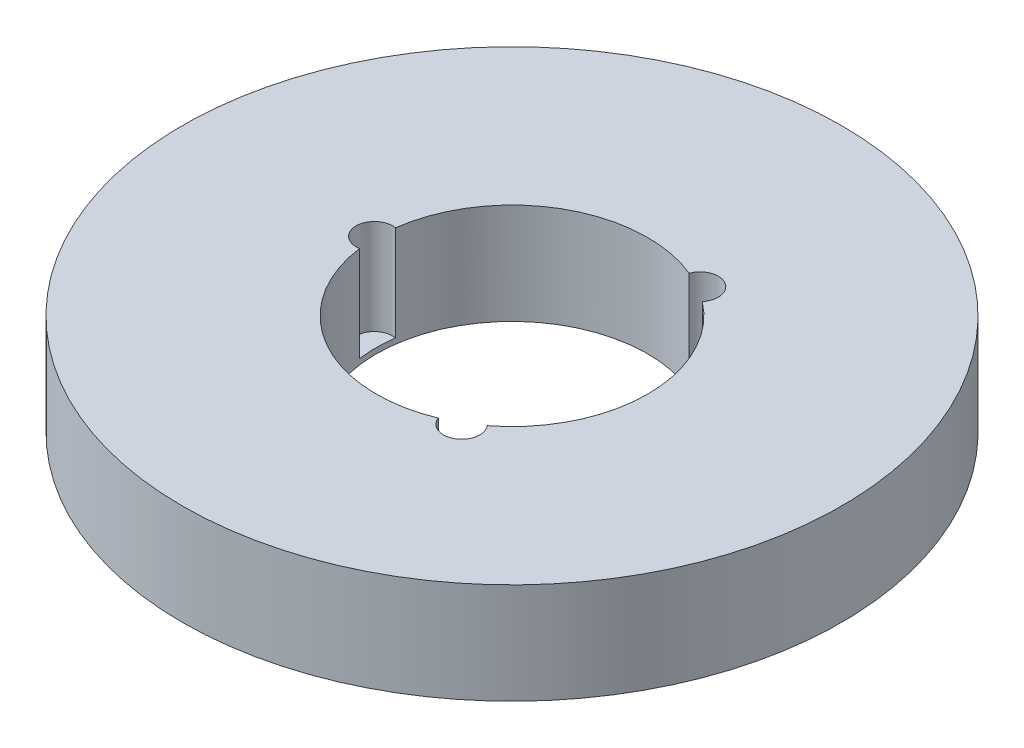
from build123d import *

# Parameters (mm, degrees)
SKETCH1_R           = 85
BOSS_EXTRUDE1_DEPTH = 26
SKETCH2_R           = 35
CUT_EXTRUDE1_DEPTH  = 123.987804273
SKETCH3_R           = 4.696834962
CUT_EXTRUDE2_DEPTH  = 24.590057638
CIRPATTERN1_COUNT   = 3


with BuildPart() as part:
    # Sketch1 → Boss-Extrude1 (new body)
    with BuildSketch(Plane(origin=(0, 0, 0), x_dir=(1, 0, 0), z_dir=(0, 1, 0))):
        Circle(SKETCH1_R)
    extrude(amount=BOSS_EXTRUDE1_DEPTH)

    # Sketch2 → Cut-Extrude1 (cut, through all)
    with BuildSketch(Plane(origin=(0, 0, 0), x_dir=(1, 0, 0), z_dir=(0, 1, 0))):
        Circle(SKETCH2_R)
    extrude(amount=CUT_EXTRUDE1_DEPTH, mode=Mode.SUBTRACT)

    # Sketch3 → Cut-Extrude2 (cut)
    with BuildSketch(Plane(origin=(0, 26, 0), x_dir=(1, 0, 0), z_dir=(0, 1, 0))):
        with Locations((-35.507515009, 0)):
            Circle(SKETCH3_R)
    cut_extrude2 = extrude(amount=-CUT_EXTRUDE2_DEPTH, mode=Mode.SUBTRACT)

    # CirPattern1: Cut-Extrude2 ×3 about axis
    cirpattern1_axis = Axis((0, 0, 0), (0, 1, 0))
    for i in range(1, CIRPATTERN1_COUNT):
        add(cut_extrude2.rotate(cirpattern1_axis, i * 360 / CIRPATTERN1_COUNT), mode=Mode.SUBTRACT)


solid = part.part
